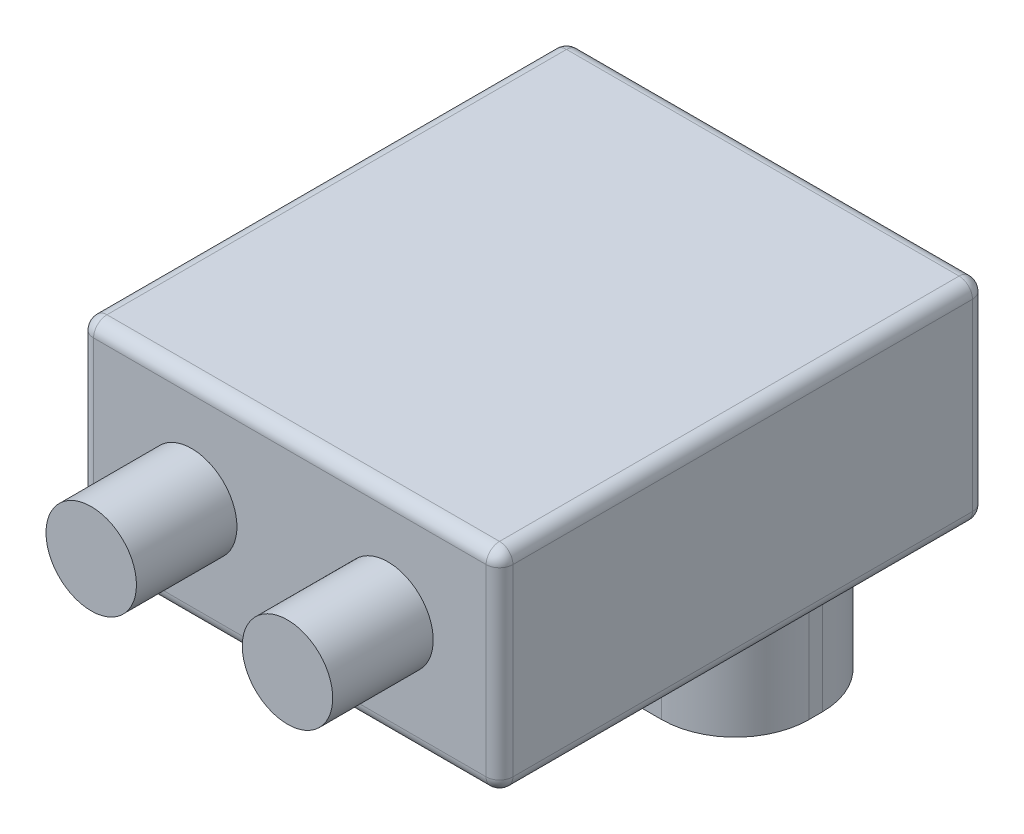
from build123d import *

# Parameters (mm, degrees)
SKETCH1_W           = 62.6
SKETCH1_H           = 72.6
BOSS_EXTRUDE1_DEPTH = 24.14
SKETCH2_W           = 50
SKETCH2_H           = 24
BOSS_EXTRUDE2_DEPTH = 19
SKETCH3_W           = 62.6
SKETCH3_H           = 72.6
BOSS_EXTRUDE3_DEPTH = 7.3
FILLET1_R           = 2
FILLET2_R           = 11
SKETCH4_R           = 6.75
BOSS_EXTRUDE4_DEPTH = 15


with BuildPart() as part:
    # Sketch1 → Boss-Extrude1 (new body)
    with BuildSketch(Plane(origin=(0, 0, 0), x_dir=(1, 0, 0), z_dir=(0, 1, 0))):
        Rectangle(SKETCH1_W, SKETCH1_H)
    extrude(amount=BOSS_EXTRUDE1_DEPTH)

    # Sketch2 → Boss-Extrude2 (add)
    with BuildSketch(Plane.XZ):
        with Locations((0, -17.2)):
            Rectangle(SKETCH2_W, SKETCH2_H)
    extrude(amount=BOSS_EXTRUDE2_DEPTH)

    # Sketch3 → Boss-Extrude3 (add)
    with BuildSketch(Plane(origin=(0, 24.14, 0), x_dir=(1, 0, 0), z_dir=(0, 1, 0))):
        Rectangle(SKETCH3_W, SKETCH3_H)
    extrude(amount=BOSS_EXTRUDE3_DEPTH)

    # Fillet1
    fillet1_edges = [part.edges().sort_by_distance(p)[0] for p in [
        (0, 0, -36.3),
        (0, 0, 36.3),
        (-31.3, 15.72, -36.3),
        (-31.3, 15.72, 36.3),
        (-31.3, 0, 0),
        (31.3, 15.72, 36.3),
        (31.3, 15.72, -36.3),
        (31.3, 0, 0),
        (0, 31.44, -36.3),
        (0, 31.44, 36.3),
        (-31.3, 31.44, 0),
        (31.3, 31.44, 0),
    ]]
    fillet(fillet1_edges, radius=FILLET1_R)

    # Fillet2
    fillet2_edges = [part.edges().sort_by_distance(p)[0] for p in [
        (25, -9.5, -5.2),
        (25, -9.5, -29.2),
        (-25, -9.5, -29.2),
        (-25, -9.5, -5.2),
    ]]
    fillet(fillet2_edges, radius=FILLET2_R)

    # Sketch4 → Boss-Extrude4 (add)
    with BuildSketch(Plane.XY.offset(36.3)):
        with Locations((-14.64999991, 15.7200005)):
            Circle(SKETCH4_R)
        with Locations((14.64999991, 15.7200005)):
            Circle(SKETCH4_R)
    extrude(amount=BOSS_EXTRUDE4_DEPTH)


solid = part.part
